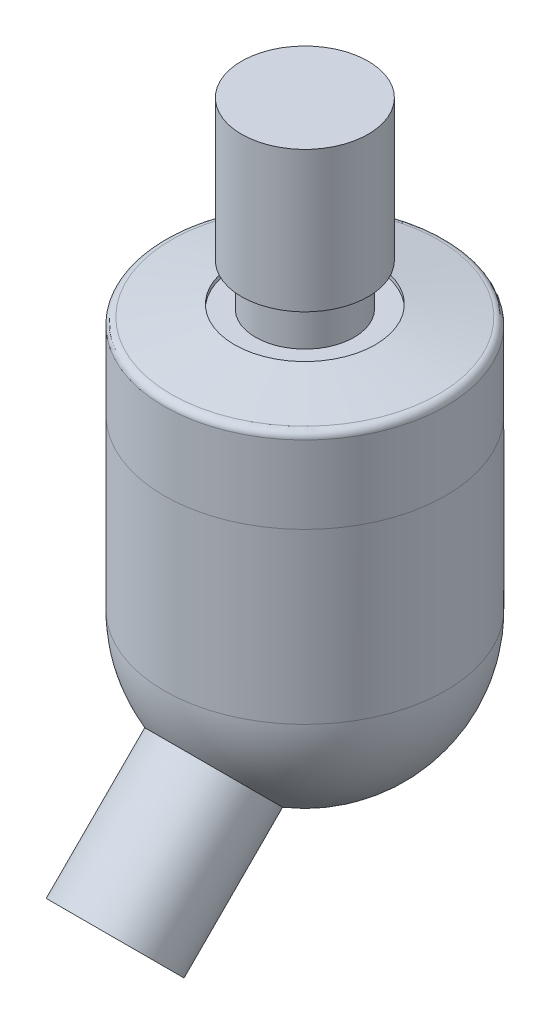
from build123d import *

# Parameters (mm, degrees)
SKETCH1_R           = 5
BOSS_EXTRUDE1_DEPTH = 6
SKETCH2_R           = 5
BOSS_EXTRUDE2_DEPTH = 3
FILLET1_R           = 0.25
SKETCH3_R           = 4.75
BOSS_EXTRUDE3_DEPTH = 0.5
BOSS_EXTRUDE3_TAPER = 80
SKETCH4_R           = 2.5
CUT_EXTRUDE1_DEPTH  = 0.25
SKETCH5_R           = 1.75
BOSS_EXTRUDE4_DEPTH = 1.5
SKETCH6_R           = 2.25
BOSS_EXTRUDE5_DEPTH = 5
SKETCH8_R           = 2
SKETCH8_R_2         = 1
BOSS_EXTRUDE6_DEPTH = 6


# Read off the part's stored shape, not the designer's step: Dome1
with BuildPart() as part:
    # Sketch1 → Boss-Extrude1 (new body)
    with BuildSketch(Plane(origin=(0, 0, 0), x_dir=(1, 0, 0), z_dir=(0, 1, 0))):
        with Locations(Location((0, 0, 0), (0, 0, 270))):
            Circle(SKETCH1_R)
    extrude(amount=BOSS_EXTRUDE1_DEPTH)

    # Dome1 outline → Dome1 (revolve)
    with BuildSketch(Plane.XY):
        with BuildLine():
            Line((0, 5e-09), (0, -5))
            ThreePointArc((0, -5), (3.535533908, -3.535533904), (5, 5e-09))
            Line((5, 5e-09), (0, 5e-09))
        make_face()
    revolve(axis=Axis((0, 0, 0), (0, 1, 0)))

    # Sketch8 → Boss-Extrude6 (add)
    with BuildSketch(Plane(origin=(0, -2.5, 2.5), x_dir=(1, 0, 0), z_dir=(0, -0.7071067811865475, 0.7071067811865477))):
        with Locations(Location((0, 0, 0), (0, 0, 90))):
            Circle(SKETCH8_R)
        with Locations(Location((0, 0, 0), (0, 0, 90))):
            Circle(SKETCH8_R_2, mode=Mode.SUBTRACT)
    extrude(amount=BOSS_EXTRUDE6_DEPTH)


with BuildPart() as body_2:
    # Sketch2 → Boss-Extrude2 (new body)
    with BuildSketch(Plane(origin=(0, 9, 0), x_dir=(1, 0, 0), z_dir=(0, 1, 0))):
        with Locations(Location((0, 0, 0), (0, 0, 270))):
            Circle(SKETCH2_R)
    extrude(amount=-BOSS_EXTRUDE2_DEPTH)

    # Fillet1
    fillet1_edges = [body_2.edges().sort_by_distance(p)[0] for p in [
        (0, 9, -5),
    ]]
    fillet(fillet1_edges, radius=FILLET1_R)

    # Sketch3 → Boss-Extrude3 (add)
    with BuildSketch(Plane(origin=(0, 9, 0), x_dir=(1, 0, 0), z_dir=(0, 1, 0))):
        Circle(SKETCH3_R)
    extrude(amount=BOSS_EXTRUDE3_DEPTH, taper=BOSS_EXTRUDE3_TAPER)

    # Sketch4 → Cut-Extrude1 (cut)
    with BuildSketch(Plane(origin=(0, 9.5, 0), x_dir=(1, 0, 0), z_dir=(0, 1, 0))):
        with Locations(Location((0, 0, 0), (0, 0, 270))):
            Circle(SKETCH4_R)
    extrude(amount=-CUT_EXTRUDE1_DEPTH, mode=Mode.SUBTRACT)

    # Sketch5 → Boss-Extrude4 (add)
    with BuildSketch(Plane(origin=(0, 9.25, 0), x_dir=(1, 0, 0), z_dir=(0, 1, 0))):
        with Locations(Location((0, 0, 0), (0, 0, 270))):
            Circle(SKETCH5_R)
    extrude(amount=BOSS_EXTRUDE4_DEPTH)

    # Sketch6 → Boss-Extrude5 (add)
    with BuildSketch(Plane(origin=(0, 10.75, 0), x_dir=(1, 0, 0), z_dir=(0, 1, 0))):
        with Locations(Location((0, 0, 0), (0, 0, 270))):
            Circle(SKETCH6_R)
    extrude(amount=BOSS_EXTRUDE5_DEPTH)


solid = Compound([part.part, body_2.part])
